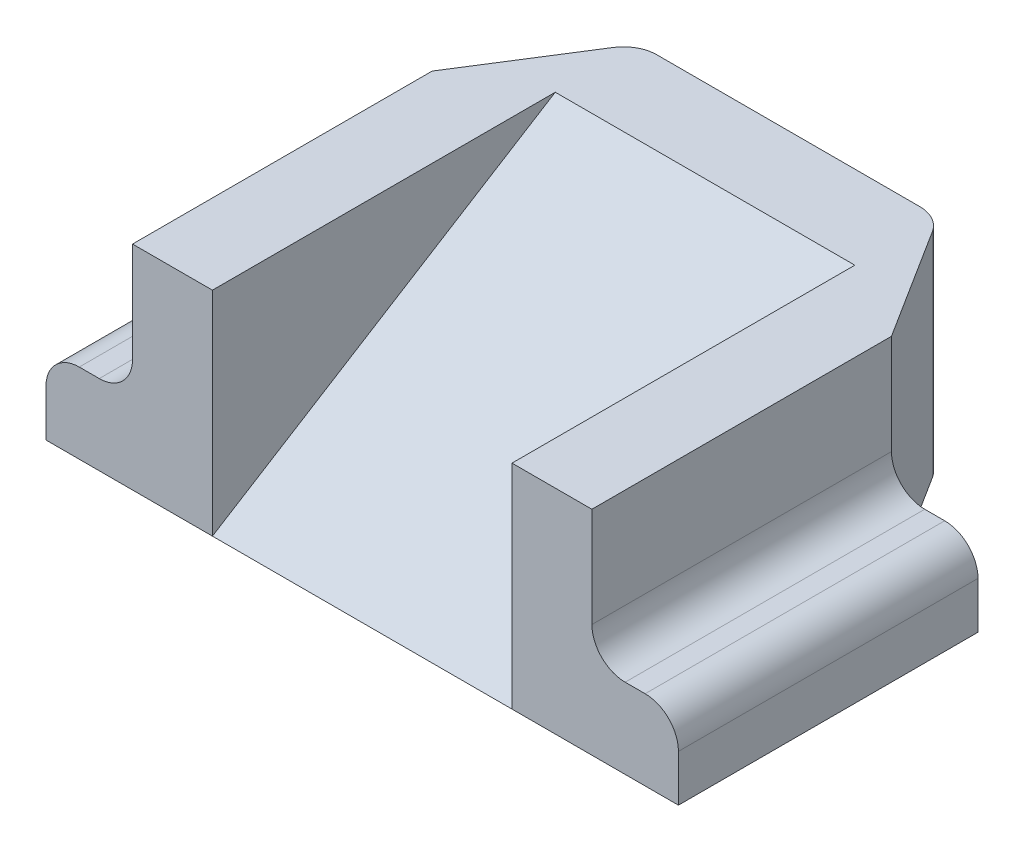
from build123d import *

# Parameters (mm, degrees)
BOSS_EXTRUDE1_DEPTH = 128
CUT_EXTRUDE1_DEPTH  = 238.865508218
CUT_EXTRUDE2_START  = 50
CUT_EXTRUDE2_DEPTH  = 90
FILLET1_R           = 10


# Read off the part's stored shape, not the designer's step: Cut-Extrude2
with BuildPart() as part:
    # Sketch1 → Boss-Extrude1 (new body)
    with BuildSketch(Plane.XY):
        Polygon((0, 24), (26, 24), (26, 64), (164, 64), (164, 24), (190, 24), (190, 0), (0, 0), align=None)
    extrude(amount=-BOSS_EXTRUDE1_DEPTH)

    # Sketch5 → Cut-Extrude1 (cut, through all)
    with BuildSketch(Plane(origin=(0, 64, 0), x_dir=(1, 0, 0), z_dir=(0, 1, 0))):
        Polygon((0, 90), (26, 90), (50, 128), (0, 128), align=None)
        Polygon((164, 90), (190, 90), (190, 128), (140, 128), align=None)
    extrude(amount=-CUT_EXTRUDE1_DEPTH, mode=Mode.SUBTRACT)

    # Cut-Extrude2 outline → Cut-Extrude2 (cut)
    with BuildSketch(Plane.YZ.offset(CUT_EXTRUDE2_START)):
        Polygon((0, 0), (64, -103), (64, 0), align=None)
    extrude(amount=CUT_EXTRUDE2_DEPTH, mode=Mode.SUBTRACT)

    # Fillet1
    fillet1_edges = [part.edges().sort_by_distance(p)[0] for p in [
        (26, 24, -45),
        (0, 24, -45),
        (190, 24, -45),
        (164, 24, -45),
        (50, 32, -128),
        (140, 32, -128),
    ]]
    fillet(fillet1_edges, radius=FILLET1_R)


solid = part.part
